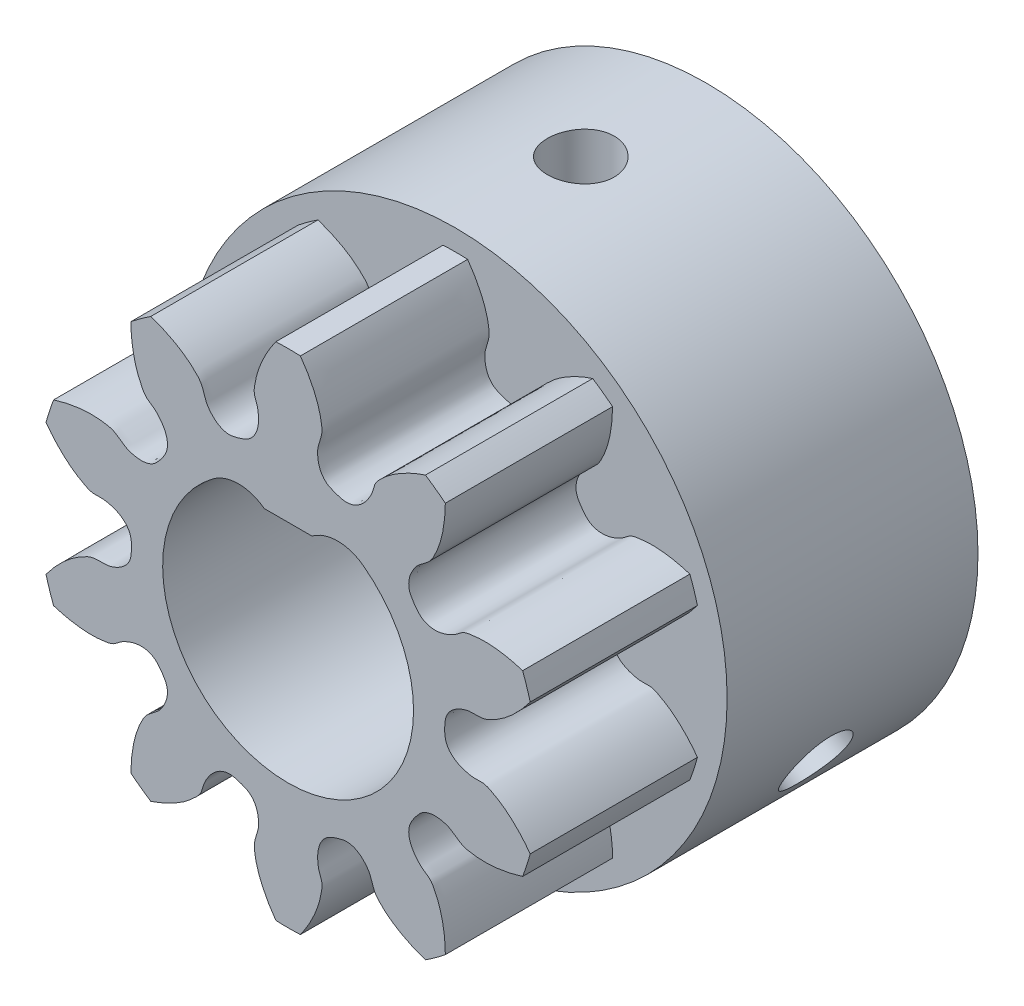
from build123d import *
from build123d.topology import SkipClean

# Parameters (mm, degrees)
SKETCHREVOLVESUN_DRIVER01_W       = 4
SKETCHREVOLVESUN_DRIVER01_H       = 5.99999991
TOOTHEXTRUDECUTSUN_DRIVER01_START = -2
TOOTHEXTRUDECUTSUN_DRIVER01_DEPTH = 4
PATTERNSUN_DRIVER01_COUNT         = 10
BOREREVOLVESKETCH_W               = 5
BOREREVOLVESKETCH_H               = 3
SKETCH5_R                         = 6.5
SKETCH5_R_2                       = 3
BOSS_EXTRUDE1_DEPTH               = 6
BOSS_EXTRUDE2_START               = -10
BOSS_EXTRUDE2_DEPTH               = 10
SKETCH7_W                         = 0.8
SKETCH7_H                         = 6.479165125
CIRPATTERN1_COUNT                 = 3


# Read off the part's stored shape, not the designer's step: ToothExtrudeCutSun_Driver01
with BuildPart() as part:
    # SketchRevolveSun_Driver01 → Sun_Driver01 (revolve)
    with BuildSketch(Plane(origin=(0, 0, 0), x_dir=(0, 0, -1), z_dir=(1, 0, 0)), mode=Mode.PRIVATE) as sun_driver01_sk:
        with Locations((0, 2.999999955)):
            Rectangle(SKETCHREVOLVESUN_DRIVER01_W, SKETCHREVOLVESUN_DRIVER01_H)
    revolve(sun_driver01_sk.sketch.rotate(Axis((0, 0, 0), (0, 0, -1)), 90), axis=Axis((0, 0, 0), (0, 0, -1)))

    # ToothExtrudeCutSun_Driver01 outline → ToothExtrudeCutSun_Driver01 (cut)
    with BuildSketch(Plane.XY.offset(TOOTHEXTRUDECUTSUN_DRIVER01_START)):
        with BuildLine():
            ThreePointArc((5.790267972, -1.572512554), (5.99999991, -1.15e-06), (5.790268575, 1.572510335))
            add(Edge.make_bspline(
                [(5.790268575, 1.572510335), (5.647185244, 1.378003876), (5.420533447, 1.124736882), (5.093969594, 0.871751522), (4.885842921, 0.750571787), (4.636317003, 0.634097849), (4.358626298, 0.680733845), (4.117593863, 0.596748337), (3.957106552, 0.506577186), (3.845039343, 0.395108792), (3.764645017, 0.253383042), (3.744942193, 0.077983996), (3.742229376, -0.100098036), (3.77327669, -0.277418564), (3.85426371, -0.406759549), (3.969790966, -0.51335039), (4.104405431, -0.591042744), (4.269641586, -0.644192254), (4.463362027, -0.683061931), (4.679745062, -0.648067229), (4.885665286, -0.75213961), (5.094032257, -0.871182305), (5.323997604, -1.050158801), (5.565585912, -1.286904196), (5.718180822, -1.474528908), (5.790267972, -1.572512554)],
                knots=[0.011287696, 0.011287696, 0.011287696, 0.011287696, 0.138799421, 0.18982862, 0.228610813, 0.266488168, 0.33235655, 0.370318475, 0.399447816, 0.429216569, 0.453028613, 0.484105769, 0.521642102, 0.546971387, 0.57838962, 0.600552184, 0.629681525, 0.659812887, 0.6920611, 0.733511832, 0.771389187, 0.81017138, 0.861200579, 0.924476786, 0.988712692, 0.988712692, 0.988712692, 0.988712692], degree=3))
        make_face()
    toothextrudecutsun_driver01 = extrude(amount=TOOTHEXTRUDECUTSUN_DRIVER01_DEPTH, mode=Mode.SUBTRACT)

    # PatternSun_Driver01: ToothExtrudeCutSun_Driver01 ×10 about axis
    patternsun_driver01_axis = Axis((0, 0, 50), (0, 0, -1))
    for i in range(1, PATTERNSUN_DRIVER01_COUNT):
        add(toothextrudecutsun_driver01.rotate(patternsun_driver01_axis, i * 360 / PATTERNSUN_DRIVER01_COUNT), mode=Mode.SUBTRACT)

    # BoreRevolveSketch → BoreRevolveCut (revolve, cut)
    with BuildSketch(Plane(origin=(0, 0, 0), x_dir=(0, 0, -1), z_dir=(1, 0, 0)), mode=Mode.PRIVATE) as borerevolvecut_sk:
        with Locations((0, 1.5)):
            Rectangle(BOREREVOLVESKETCH_W, BOREREVOLVESKETCH_H)
    revolve(borerevolvecut_sk.sketch.rotate(Axis((0, 0, 0), (0, 0, -1)), 90), axis=Axis((0, 0, 0), (0, 0, -1)), mode=Mode.SUBTRACT)

    # Sketch5 → Boss-Extrude1 (add)
    with SkipClean():  # the faces are left unmerged after this step: merging them gives an invalid solid
        with BuildSketch(Plane(origin=(0, 0, -2), x_dir=(-1, 0, 0), z_dir=(0, 0, -1))):
            Circle(SKETCH5_R)
            Circle(SKETCH5_R_2, mode=Mode.SUBTRACT)
        extrude(amount=BOSS_EXTRUDE1_DEPTH)
    add(part.part.scale(1), mode=Mode.REPLACE)  # the faces are merged on a copy

    # Sketch6 → Boss-Extrude2 (add)
    with BuildSketch(Plane(origin=(0, 0, -8), x_dir=(-1, 0, 0), z_dir=(0, 0, -1)).offset(BOSS_EXTRUDE2_START)):
        with BuildLine():
            Line((-0.57, 2.4), (0.57, 2.4))
            ThreePointArc((0.57, 2.4), (1.185, 2.605), (1.8, 2.4))
            ThreePointArc((1.8, 2.4), (0, 3), (-1.8, 2.4))
            ThreePointArc((-1.8, 2.4), (-1.185, 2.605), (-0.57, 2.4))
        make_face()
    extrude(amount=BOSS_EXTRUDE2_DEPTH)

    # Sketch7 → Tap Drill for M2 Tap1 (revolve, cut)
    with BuildSketch(Plane(origin=(0, 2.4, -5), x_dir=(0, 0, -1), z_dir=(1, 0, 0))):
        with Locations((0.4, 3.239582563)):
            Rectangle(SKETCH7_W, SKETCH7_H)
    tap_drill_for_m2_tap1 = revolve(axis=Axis((0, -3.95, -5), (0, 1, 0)), mode=Mode.SUBTRACT)

    # CirPattern1: Tap Drill for M2 Tap1 ×3 about axis, 1 skipped
    cirpattern1_axis = Axis((0, 0, 0), (0, 0, -1))
    add([tap_drill_for_m2_tap1.rotate(cirpattern1_axis, i * 360 / CIRPATTERN1_COUNT) for i in range(1, CIRPATTERN1_COUNT) if i not in (2,)], mode=Mode.SUBTRACT)


solid = part.part
